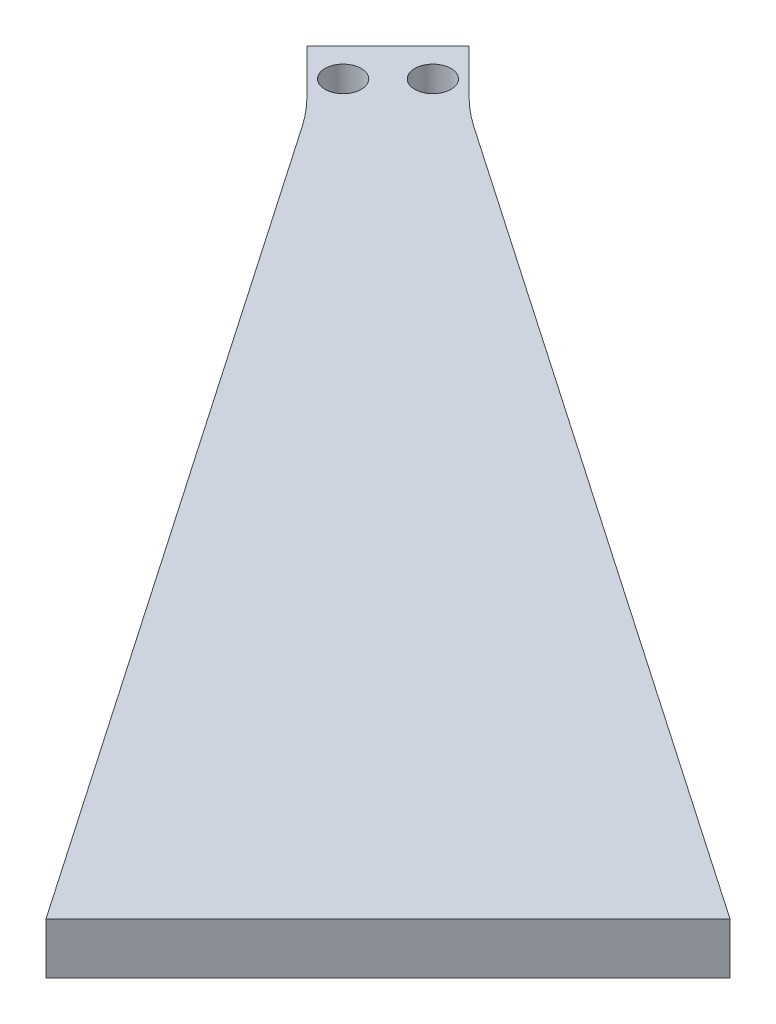
from build123d import *

# Parameters (mm, degrees)
SKETCH1_R           = 2.25
BOSS_EXTRUDE1_DEPTH = 3.175
FILLET1_R           = 25


with BuildPart() as part:
    # Sketch1 → Boss-Extrude1 (new, symmetric)
    with BuildSketch(Plane(origin=(0, 0, 0), x_dir=(1, 0, 0), z_dir=(0, 1, 0))):
        Polygon((9.733324843, -19.788383272), (80.256619665, -122.683026536), (122.683026536, -80.256619665), (19.788383272, -9.733324843), (12.71731546, -2.662257031), (2.662257031, -12.71731546), align=None)
        with Locations((8.441440754, -14.009199549)):
            Circle(SKETCH1_R, mode=Mode.SUBTRACT)
        with Locations((14.009199549, -8.441440754)):
            Circle(SKETCH1_R, mode=Mode.SUBTRACT)
    extrude(amount=BOSS_EXTRUDE1_DEPTH, both=True)

    # Fillet1
    fillet1_edges = [part.edges().sort_by_distance(p)[0] for p in [
        (19.788383272, 0, 9.733324843),
        (9.733324843, 0, 19.788383272),
    ]]
    fillet(fillet1_edges, radius=FILLET1_R)


solid = part.part
